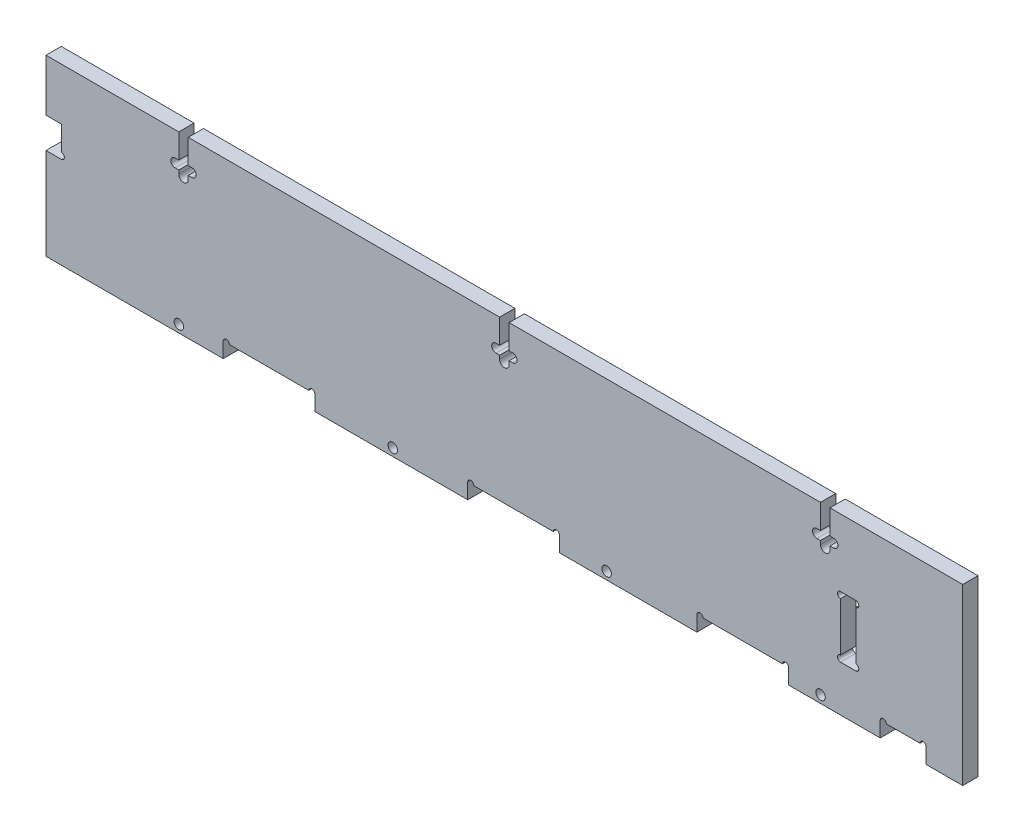
from build123d import *

# Parameters (mm, degrees)
SKETCH_1_W          = 300
SKETCH_1_H          = 57
EXTRUDE_1_DEPTH     = 5
SKETCH_2_W          = 5
SKETCH_2_H          = 10
SKETCH_2_W_2        = 30
SKETCH_2_H_2        = 5
SKETCH_2_W_3        = 15
SKETCH_2_H_3        = 20
CUT_EXTRUDE_1_DEPTH = 5
SKETCH_3_R          = 1
CUT_EXTRUDE_2_DEPTH = 5
SKETCH_4_R          = 1.55
CUT_EXTRUDE_3_DEPTH = 10
CUT_EXTRUDE_4_DEPTH = 10


with BuildPart() as part:
    # 스케치1 → 보스-돌출1 (new body)
    with BuildSketch(Plane.XY):
        with Locations((150, 28.5)):
            Rectangle(SKETCH_1_W, SKETCH_1_H)
    extrude(amount=EXTRUDE_1_DEPTH)

    # 스케치2 → 컷-돌출1 (cut)
    with BuildSketch(Plane.XY.offset(5)):
        with Locations((2.5, 35)):
            Rectangle(SKETCH_2_W, SKETCH_2_H)
        with Locations((73, 2.5)):
            Rectangle(SKETCH_2_W_2, SKETCH_2_H_2)
        with Locations((153, 2.5)):
            Rectangle(SKETCH_2_W_2, SKETCH_2_H_2)
        with Locations((228, 2.5)):
            Rectangle(SKETCH_2_W_2, SKETCH_2_H_2)
        with Locations((280.5, 2.5)):
            Rectangle(SKETCH_2_W_3, SKETCH_2_H_2)
        with Locations((262.5, 25)):
            Rectangle(SKETCH_2_W, SKETCH_2_H_3)
    extrude(amount=-CUT_EXTRUDE_1_DEPTH, mode=Mode.SUBTRACT)

    # 스케치3 → 컷-돌출2 (cut)
    with BuildSketch(Plane.XY.offset(5)):
        with Locations((274, 5)):
            Circle(SKETCH_3_R)
        with Locations((287, 5)):
            Circle(SKETCH_3_R)
        with Locations((260, 16)):
            Circle(SKETCH_3_R)
        with Locations((265, 16)):
            Circle(SKETCH_3_R)
        with Locations((265, 34)):
            Circle(SKETCH_3_R)
        with Locations((260, 34)):
            Circle(SKETCH_3_R)
        with Locations((214, 5)):
            Circle(SKETCH_3_R)
        with Locations((242, 5)):
            Circle(SKETCH_3_R)
        with Locations((87, 5)):
            Circle(SKETCH_3_R)
        with Locations((139, 5)):
            Circle(SKETCH_3_R)
        with Locations((167, 5)):
            Circle(SKETCH_3_R)
        with Locations((5, 31)):
            Circle(SKETCH_3_R)
        with Locations((59, 5)):
            Circle(SKETCH_3_R)
    extrude(amount=-CUT_EXTRUDE_2_DEPTH, mode=Mode.SUBTRACT)

    # 스케치4 → 컷-돌출3 (cut)
    with BuildSketch(Plane(origin=(0, 0, 0), x_dir=(-1, 0, 0), z_dir=(0, 0, -1))):
        with Locations((-253.478741621, 2.5)):
            Circle(SKETCH_4_R)
        with Locations((-183.478741621, 2.5)):
            Circle(SKETCH_4_R)
        with Locations((-113.478741621, 2.5)):
            Circle(SKETCH_4_R)
        with Locations((-43.478741621, 2.5)):
            Circle(SKETCH_4_R)
    extrude(amount=-CUT_EXTRUDE_3_DEPTH, mode=Mode.SUBTRACT)

    # 스케치5 → 컷-돌출4 (cut)
    with BuildSketch(Plane.XY.offset(5)):
        with BuildLine():
            Line((43.45, 57), (43.45, 49))
            Line((43.45, 49), (42.25, 49))
            ThreePointArc((42.25, 49), (40.85, 47.6), (42.25, 46.2))
            Line((42.25, 46.2), (43.45, 46.2))
            Line((43.45, 46.2), (43.45, 45))
            ThreePointArc((43.45, 45), (45, 43.45), (46.55, 45))
            Line((46.55, 45), (46.55, 46.2))
            Line((46.55, 46.2), (47.75, 46.2))
            ThreePointArc((47.75, 46.2), (49.15, 47.6), (47.75, 49))
            Line((47.75, 49), (46.55, 49))
            Line((46.55, 49), (46.55, 57))
            Line((46.55, 57), (43.45, 57))
        make_face()
        with BuildLine():
            Line((151.55, 49), (152.75, 49))
            ThreePointArc((152.75, 49), (154.15, 47.6), (152.75, 46.2))
            Line((152.75, 46.2), (151.55, 46.2))
            Line((151.55, 46.2), (151.55, 45))
            ThreePointArc((151.55, 45), (150, 43.45), (148.45, 45))
            Line((148.45, 45), (148.45, 46.2))
            Line((148.45, 46.2), (147.25, 46.2))
            ThreePointArc((147.25, 46.2), (145.85, 47.6), (147.25, 49))
            Line((147.25, 49), (148.45, 49))
            Line((148.45, 49), (148.45, 57))
            Line((148.45, 57), (151.55, 57))
            Line((151.55, 57), (151.55, 49))
        make_face()
        with BuildLine():
            Line((256.55, 49), (257.75, 49))
            ThreePointArc((257.75, 49), (259.15, 47.6), (257.75, 46.2))
            Line((257.75, 46.2), (256.55, 46.2))
            Line((256.55, 46.2), (256.55, 45))
            ThreePointArc((256.55, 45), (255, 43.45), (253.45, 45))
            Line((253.45, 45), (253.45, 46.2))
            Line((253.45, 46.2), (252.25, 46.2))
            ThreePointArc((252.25, 46.2), (250.85, 47.6), (252.25, 49))
            Line((252.25, 49), (253.45, 49))
            Line((253.45, 49), (253.45, 57))
            Line((253.45, 57), (256.55, 57))
            Line((256.55, 57), (256.55, 49))
        make_face()
    extrude(amount=-CUT_EXTRUDE_4_DEPTH, mode=Mode.SUBTRACT)


solid = part.part
